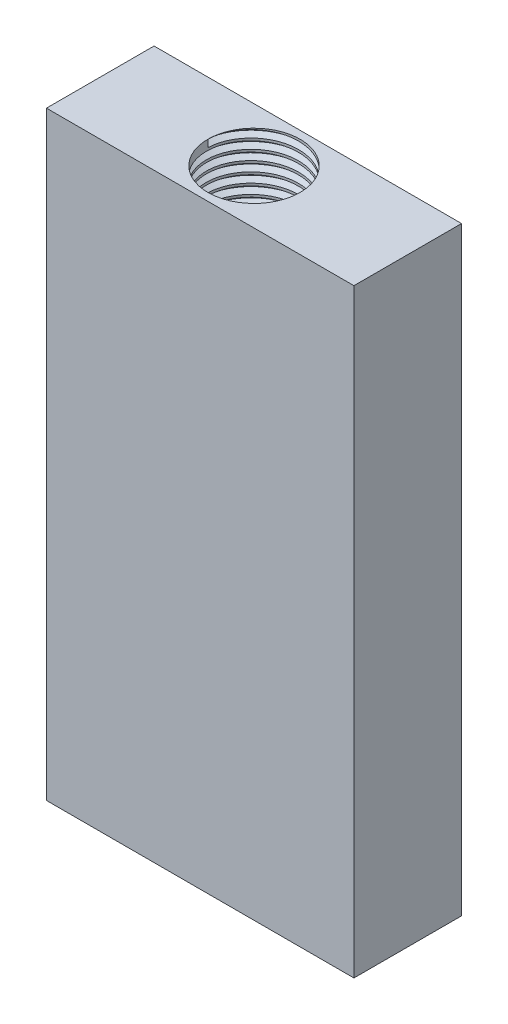
from build123d import *
from build123d.topology import SkipClean

# Parameters (mm, degrees)
SKETCH2_W           = 10
SKETCH2_H           = 19.5
BOSS_EXTRUDE1_DEPTH = 3.5
SKETCH11_R          = 1.5
CUT_EXTRUDE1_DEPTH  = 3.5
THREAD1_PITCH       = 0.3175
CUT_EXTRUDE2_START  = -3.5
SKETCH15_R          = 1.5
CUT_EXTRUDE2_DEPTH  = 3.5
THREAD2_PITCH       = 0.3175


with BuildPart() as part:
    # Sketch2 → Boss-Extrude1 (new body)
    with BuildSketch(Plane.XY):
        with Locations((0, -17.6)):
            Rectangle(SKETCH2_W, SKETCH2_H)
    extrude(amount=BOSS_EXTRUDE1_DEPTH)

    # Sketch11 → Cut-Extrude1 (cut)
    with BuildSketch(Plane(origin=(0, -7.85, 0), x_dir=(1, 0, 0), z_dir=(0, 1, 0))):
        with Locations(Location((0, -1.75, 0), (0, 0, 270))):
            Circle(SKETCH11_R)
    extrude(amount=-CUT_EXTRUDE1_DEPTH, mode=Mode.SUBTRACT)

    # Thread1: the profile of Thread Profile1 profile screwed along a right-hand helix of 11.023622 turns, 6 arcs to a turn; built about Z, then put on its axis
    with SkipClean():  # the faces are left unmerged after this step: merging them gives an invalid solid
        thread1_z = Axis((0, 0, 0), (0, 0, 1))
        thread1_corners = [(1.4997, 0, -0.000173205), (1.671851915, 0, 0.09921875), (1.671851915, 0, 0.13890625), (1.4997, 0, 0.238298204)]
        with BuildLine(mode=Mode.PRIVATE) as thread1_profile:
            Line(thread1_corners[0], thread1_corners[1])
            Line(thread1_corners[1], thread1_corners[2])
            Line(thread1_corners[2], thread1_corners[3])
            Line(thread1_corners[3], thread1_corners[0])
        thread1_cap = Face(thread1_profile.wire())
        thread1_turn_angles = [0, 30, 60, 90, 120, 150, 180, 210, 240, 270, 300, 330, 360]
        thread1_turn_weights = [1, 0.8660254037844387, 1, 0.8660254037844387, 1, 0.8660254037844387, 1, 0.8660254037844387, 1, 0.8660254037844387, 1, 0.8660254037844387, 1]
        thread1_turn_rails = [Edge.make_bspline([Vector(p[0], p[1], 0).rotate(thread1_z, thread1_turn_angles[k]) / thread1_turn_weights[k] + Vector(0, 0, p[2] + THREAD1_PITCH * thread1_turn_angles[k] / 360) for k in range(13)], [0, 0, 0, 1, 1, 2, 2, 3, 3, 4, 4, 5, 5, 6, 6, 6], 2, thread1_turn_weights) for p in thread1_corners]
        thread1_turn_sides = [Face.make_surface_from_curves(thread1_turn_rails[p[0]], thread1_turn_rails[p[1]]) for p in [(0, 1), (1, 2), (2, 3), (3, 0)]]
        thread1_last_angles = [3960, 3964.251968504, 3968.503937008]
        thread1_last_weights = [1, 0.997247638374775, 1]
        thread1_last_rails = [Edge.make_bspline([Vector(p[0], p[1], 0).rotate(thread1_z, thread1_last_angles[k]) / thread1_last_weights[k] + Vector(0, 0, p[2] + THREAD1_PITCH * thread1_last_angles[k] / 360) for k in range(3)], [0, 0, 0, 1, 1, 1], 2, thread1_last_weights) for p in thread1_corners]
        thread1_last_sides = [Face.make_surface_from_curves(thread1_last_rails[p[0]], thread1_last_rails[p[1]]) for p in [(0, 1), (1, 2), (2, 3), (3, 0)]]
        thread1 = Plane(origin=(0, -7.85, 1.75), x_dir=(-1, 0, 0), z_dir=(0, -1, 0)) * Solid(Shell([*[p.moved(Location((0, 0, THREAD1_PITCH * i))) for i in range(11) for p in thread1_turn_sides], *thread1_last_sides, thread1_cap, thread1_cap.rotate(thread1_z, 3968.503937008).moved(Location((0, 0, THREAD1_PITCH * 3968.503937008 / 360)))]))
        add(thread1, mode=Mode.SUBTRACT)

    # Sketch15 → Cut-Extrude2 (cut)
    with SkipClean():  # the faces are left unmerged after this step: merging them gives an invalid solid
        with BuildSketch(Plane(origin=(0, -27.35, 0), x_dir=(-1, 0, 0), z_dir=(0, -1, 0)).offset(CUT_EXTRUDE2_START)):
            with Locations(Location((0, -1.75, 0), (0, 0, 90))):
                Circle(SKETCH15_R)
        extrude(amount=CUT_EXTRUDE2_DEPTH, mode=Mode.SUBTRACT)

    # Thread2: the profile of Thread Profile2 profile screwed along a right-hand helix of 11.023622 turns, 6 arcs to a turn; built about Z, then put on its axis
    with SkipClean():  # the faces are left unmerged after this step: merging them gives an invalid solid
        thread2_z = Axis((0, 0, 0), (0, 0, 1))
        thread2_corners = [(1.4997, 0, -0.000173205), (1.671851915, 0, 0.09921875), (1.671851915, 0, 0.13890625), (1.4997, 0, 0.238298204)]
        with BuildLine(mode=Mode.PRIVATE) as thread2_profile:
            Line(thread2_corners[0], thread2_corners[1])
            Line(thread2_corners[1], thread2_corners[2])
            Line(thread2_corners[2], thread2_corners[3])
            Line(thread2_corners[3], thread2_corners[0])
        thread2_cap = Face(thread2_profile.wire())
        thread2_turn_angles = [0, 30, 60, 90, 120, 150, 180, 210, 240, 270, 300, 330, 360]
        thread2_turn_weights = [1, 0.8660254037844387, 1, 0.8660254037844387, 1, 0.8660254037844387, 1, 0.8660254037844387, 1, 0.8660254037844387, 1, 0.8660254037844387, 1]
        thread2_turn_rails = [Edge.make_bspline([Vector(p[0], p[1], 0).rotate(thread2_z, thread2_turn_angles[k]) / thread2_turn_weights[k] + Vector(0, 0, p[2] + THREAD2_PITCH * thread2_turn_angles[k] / 360) for k in range(13)], [0, 0, 0, 1, 1, 2, 2, 3, 3, 4, 4, 5, 5, 6, 6, 6], 2, thread2_turn_weights) for p in thread2_corners]
        thread2_turn_sides = [Face.make_surface_from_curves(thread2_turn_rails[p[0]], thread2_turn_rails[p[1]]) for p in [(0, 1), (1, 2), (2, 3), (3, 0)]]
        thread2_last_angles = [3960, 3964.251968504, 3968.503937008]
        thread2_last_weights = [1, 0.997247638374775, 1]
        thread2_last_rails = [Edge.make_bspline([Vector(p[0], p[1], 0).rotate(thread2_z, thread2_last_angles[k]) / thread2_last_weights[k] + Vector(0, 0, p[2] + THREAD2_PITCH * thread2_last_angles[k] / 360) for k in range(3)], [0, 0, 0, 1, 1, 1], 2, thread2_last_weights) for p in thread2_corners]
        thread2_last_sides = [Face.make_surface_from_curves(thread2_last_rails[p[0]], thread2_last_rails[p[1]]) for p in [(0, 1), (1, 2), (2, 3), (3, 0)]]
        thread2 = Plane(origin=(0, -27.35, 1.75), x_dir=(1, 0, 0), z_dir=(0, 1, 0)) * Solid(Shell([*[p.moved(Location((0, 0, THREAD2_PITCH * i))) for i in range(11) for p in thread2_turn_sides], *thread2_last_sides, thread2_cap, thread2_cap.rotate(thread2_z, 3968.503937008).moved(Location((0, 0, THREAD2_PITCH * 3968.503937008 / 360)))]))
        add(thread2, mode=Mode.SUBTRACT)


solid = part.part
